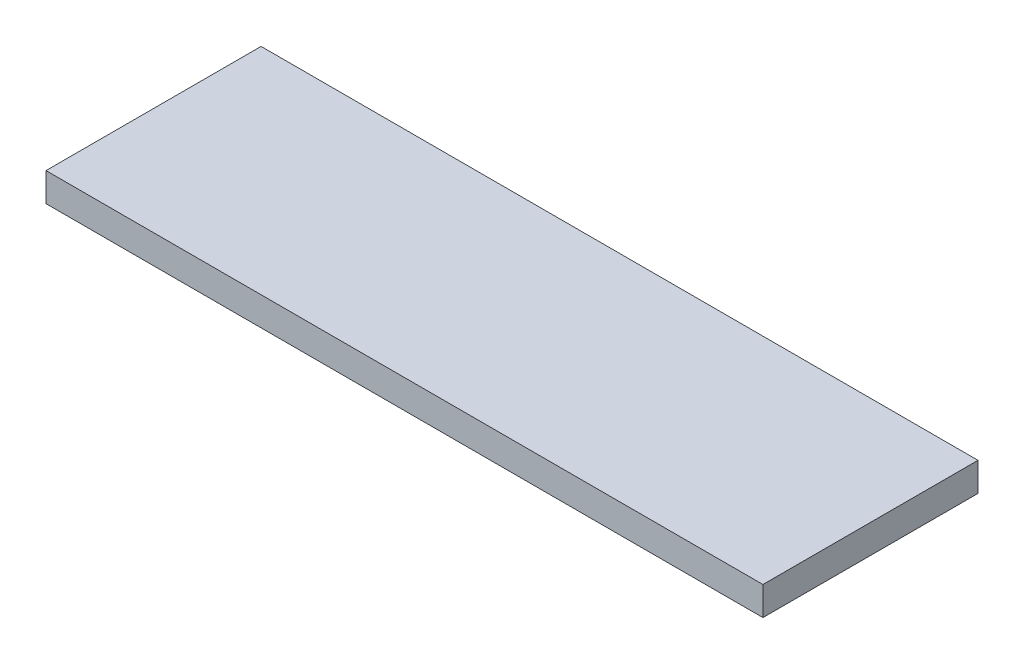
from build123d import *

# Parameters (mm, degrees)
ESQUISSE1_W        = 500
ESQUISSE1_H        = 150
BOSS_EXTRU_1_DEPTH = 20


with BuildPart() as part:
    # Esquisse1 → Boss.-Extru.1 (new body)
    with BuildSketch(Plane(origin=(0, 0, 0), x_dir=(1, 0, 0), z_dir=(0, 1, 0))):
        Rectangle(ESQUISSE1_W, ESQUISSE1_H)
    extrude(amount=BOSS_EXTRU_1_DEPTH)


solid = part.part
